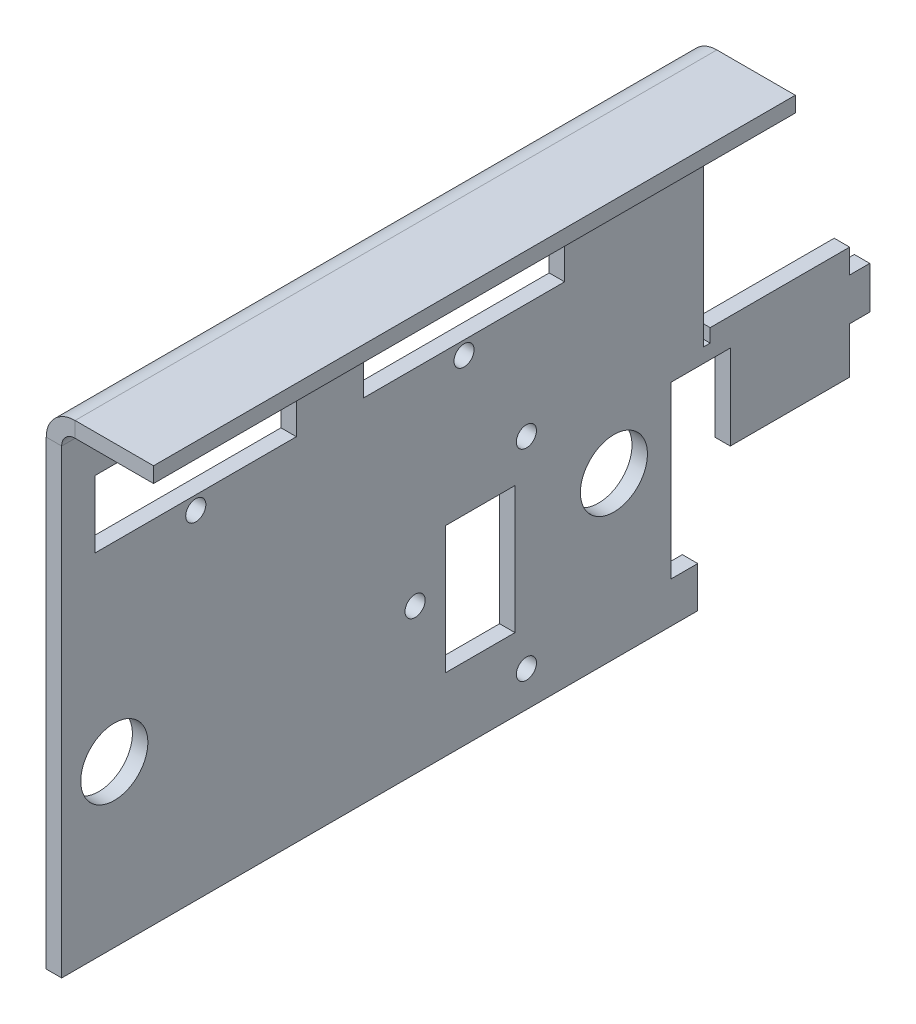
from build123d import *

# Parameters (mm, degrees)
BASE_FLANGE1_DEPTH      = 94.85
BASE_FLANGE1_DEPTH_BACK = 25.65
SKETCH7_R               = 1.5
SKETCH7_R_2             = 5
SKETCH7_W               = 10.4
SKETCH7_H               = 19
SKETCH7_W_2             = 30
SKETCH7_H_2             = 10
CUT_EXTRUDE2_DEPTH      = 121.75397509


# Sheet-metal steps are written as plain solids
with BuildPart() as part:
    # Sketch2 → Base-Flange1 (new, two sides: drawn at the far end of the back side and taken through both)
    with BuildSketch(Plane.XY.offset(-BASE_FLANGE1_DEPTH_BACK)):
        with BuildLine():
            Line((0, 0), (0, 68.7))
            ThreePointArc((0, 68.7), (1.259440841, 71.740559159), (4.3, 73))
            Line((4.3, 73), (16, 73))
            Line((16, 73), (16, 70.7))
            Line((16, 70.7), (4.3, 70.7))
            ThreePointArc((4.3, 70.7), (2.885786438, 70.114213562), (2.3, 68.7))
            Line((2.3, 68.7), (2.3, 0))
            Line((2.3, 0), (0, 0))
        make_face()
    extrude(amount=BASE_FLANGE1_DEPTH + BASE_FLANGE1_DEPTH_BACK)

    # Sketch7 → Cut-Extrude2 (cut, through all)
    with BuildSketch(Plane.ZY):
        with Locations((34.85, 64.4)):
            Circle(SKETCH7_R)
        with Locations((34.85, 50.4)):
            Circle(SKETCH7_R)
        with Locations((74.85, 64.4)):
            Circle(SKETCH7_R)
        with Locations((74.85, 50.4)):
            Circle(SKETCH7_R)
        with Locations((25.55, 35.3)):
            Circle(SKETCH7_R)
        with Locations((25.55, 5.3)):
            Circle(SKETCH7_R)
        with Locations((42.15, 21.7)):
            Circle(SKETCH7_R)
        with Locations((87, 24)):
            Circle(SKETCH7_R_2)
        with Locations((12.5, 24)):
            Circle(SKETCH7_R_2)
        with Locations((32.45, 20.3)):
            Rectangle(SKETCH7_W, SKETCH7_H)
        with Locations((74.85, 57.4)):
            Rectangle(SKETCH7_W_2, SKETCH7_H_2)
        with Locations((34.85, 57.4)):
            Rectangle(SKETCH7_W_2, SKETCH7_H_2)
        Polygon((-0.85, 33.637171027), (-1.85, 33.637171027), (-1.85, 35.637171027), (-22.65, 35.637171027), (-22.65, 32.037171027), (-25.65, 32.037171027), (-25.65, 73), (-0.85, 73), align=None)
        Polygon((-22.65, 25.737171027), (-22.65, 18.837171027), (-4.85, 18.837171027), (-4.85, 31.5), (4, 31.5), (4, 6.1), (0, 6.1), (0, 0), (-25.65, 0), (-25.65, 25.737171027), align=None)
    extrude(amount=-CUT_EXTRUDE2_DEPTH, mode=Mode.SUBTRACT)


solid = part.part
